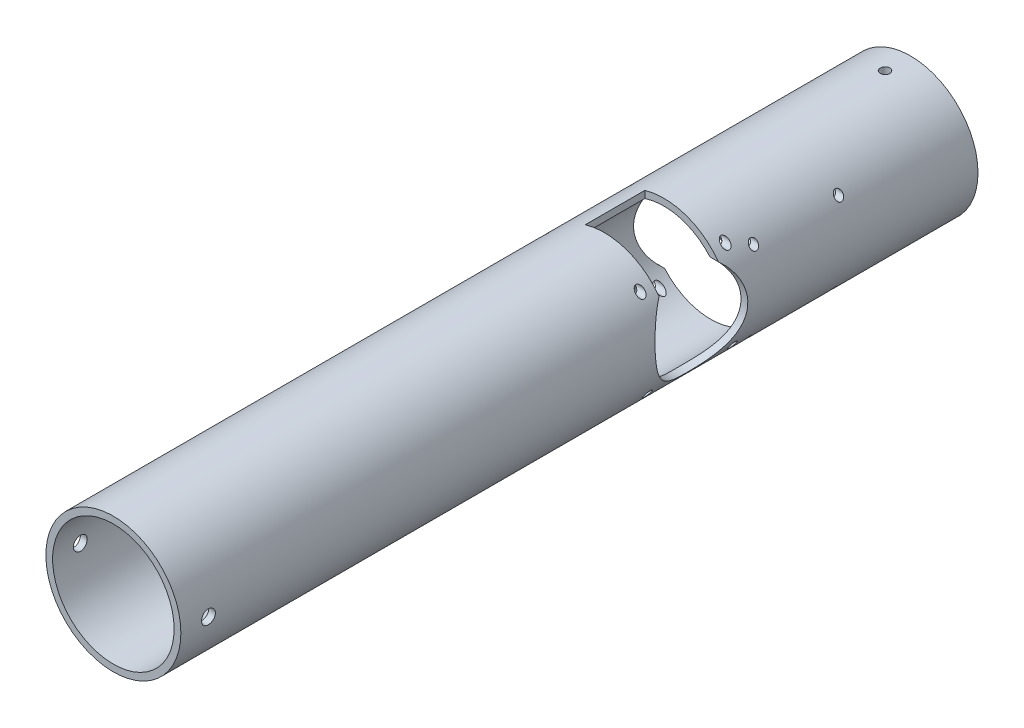
from build123d import *

# Parameters (mm, degrees)
BOSS_EXTRUDE1_DEPTH      = 125
BOSS_EXTRUDE1_DEPTH_BACK = 250
SKETCH1_R                = 31.75
SKETCH1_R_2              = 28.575
SKETCH2_R                = 21.75
CUT_EXTRUDE1_DEPTH       = 255.000246063
SKETCH3_R                = 21.75
CUT_EXTRUDE2_DEPTH       = 255.000246186
CUT_EXTRUDE4_START       = 9
SKETCH5_W                = 28
SKETCH5_H                = 22
CUT_EXTRUDE4_DEPTH       = 264.000246186
CUT_EXTRUDE5_START       = -9
SKETCH6_W                = 28
SKETCH6_H                = 22
CUT_EXTRUDE5_DEPTH       = 264.000246186
CUT_EXTRUDE8_DEPTH       = 255.000246186
CUT_EXTRUDE8_DEPTH_BACK  = 255.000246186
SKETCH11_R               = 2
CUT_EXTRUDE10_DEPTH      = 255.000246186
CUT_EXTRUDE10_DEPTH_BACK = 255.000246186
SKETCH12_R               = 3.25
CUT_EXTRUDE11_DEPTH      = 255.000246186
CUT_EXTRUDE11_DEPTH_BACK = 255.000246186
SKETCH13_R               = 2.25
CUT_EXTRUDE12_DEPTH      = 255.000246189
CUT_EXTRUDE12_DEPTH_BACK = 255.000246189
SKETCH15_R               = 2


with BuildPart() as part:
    # Sketch1 → Boss-Extrude1 (new, two sides: drawn at the far end of the back side and taken through both)
    with BuildSketch(Plane.XY.offset(-BOSS_EXTRUDE1_DEPTH_BACK)):
        Circle(SKETCH1_R)
        Circle(SKETCH1_R_2, mode=Mode.SUBTRACT)
    extrude(amount=BOSS_EXTRUDE1_DEPTH + BOSS_EXTRUDE1_DEPTH_BACK)

    # Sketch2 → Cut-Extrude1 (cut, through all)
    with BuildSketch(Plane(origin=(0, 0, 0), x_dir=(0, 0, -1), z_dir=(1, 0, 0))):
        with Locations((170, -2)):
            Circle(SKETCH2_R)
    extrude(amount=-CUT_EXTRUDE1_DEPTH, mode=Mode.SUBTRACT)

    # Sketch3 → Cut-Extrude2 (cut, through all)
    with BuildSketch(Plane(origin=(0, 0, 0), x_dir=(0, 0, -1), z_dir=(1, 0, 0))):
        with Locations((120, 2)):
            Circle(SKETCH3_R)
    extrude(amount=CUT_EXTRUDE2_DEPTH, mode=Mode.SUBTRACT)

    # Sketch5 → Cut-Extrude4 (cut, through all)
    with BuildSketch(Plane(origin=(0, 0, 0), x_dir=(0, 0, -1), z_dir=(1, 0, 0)).offset(CUT_EXTRUDE4_START)):
        with Locations((170, -23.75)):
            Rectangle(SKETCH5_W, SKETCH5_H)
    extrude(amount=-CUT_EXTRUDE4_DEPTH, mode=Mode.SUBTRACT)

    # Sketch6 → Cut-Extrude5 (cut, through all)
    with BuildSketch(Plane(origin=(0, 0, 0), x_dir=(0, 0, -1), z_dir=(1, 0, 0)).offset(CUT_EXTRUDE5_START)):
        with Locations((120, 23.75)):
            Rectangle(SKETCH6_W, SKETCH6_H)
    extrude(amount=CUT_EXTRUDE5_DEPTH, mode=Mode.SUBTRACT)

    # Sketch11 → Cut-Extrude8 (cut, two sides: drawn at the far end of the back side and taken through both)
    with BuildSketch(Plane(origin=(0, 0, 0), x_dir=(0, 0, -1), z_dir=(1, 0, 0)).offset(-CUT_EXTRUDE8_DEPTH_BACK)):
        with Locations((190, 18)):
            Circle(SKETCH11_R)
        with Locations((150, 18)):
            Circle(SKETCH11_R)
        with Locations((150, -22)):
            Circle(SKETCH11_R)
        with Locations((190, -22)):
            Circle(SKETCH11_R)
    extrude(amount=CUT_EXTRUDE8_DEPTH + CUT_EXTRUDE8_DEPTH_BACK, mode=Mode.SUBTRACT)

    # Sketch12 → Cut-Extrude10 (cut, two sides: drawn at the far end of the back side and taken through both)
    with BuildSketch(Plane(origin=(0, 0, 0), x_dir=(0, 0, -1), z_dir=(1, 0, 0)).offset(-CUT_EXTRUDE10_DEPTH_BACK)):
        with Locations((-136, 0)):
            Circle(SKETCH12_R)
        with Locations((-112, 0)):
            Circle(SKETCH12_R)
    extrude(amount=CUT_EXTRUDE10_DEPTH + CUT_EXTRUDE10_DEPTH_BACK, mode=Mode.SUBTRACT)

    # Sketch13 → Cut-Extrude11 (cut, two sides: drawn at the far end of the back side and taken through both)
    with BuildSketch(Plane(origin=(0, 0, 0), x_dir=(1, 0, 0), z_dir=(0, 1, 0)).offset(-CUT_EXTRUDE11_DEPTH_BACK)):
        with Locations((0, 238)):
            Circle(SKETCH13_R)
    extrude(amount=CUT_EXTRUDE11_DEPTH + CUT_EXTRUDE11_DEPTH_BACK, mode=Mode.SUBTRACT)

    # Sketch15 → Cut-Extrude12 (cut, two sides: drawn at the far end of the back side and taken through both)
    with BuildSketch(Plane(origin=(0, 0, 0), x_dir=(0, 0, -1), z_dir=(1, 0, 0)).offset(-CUT_EXTRUDE12_DEPTH_BACK)):
        with Locations((100, 22)):
            Circle(SKETCH15_R)
        with Locations((140, 22)):
            Circle(SKETCH15_R)
        with Locations((140, -18)):
            Circle(SKETCH15_R)
        with Locations((100, -18)):
            Circle(SKETCH15_R)
    extrude(amount=CUT_EXTRUDE12_DEPTH + CUT_EXTRUDE12_DEPTH_BACK, mode=Mode.SUBTRACT)


solid = part.part
